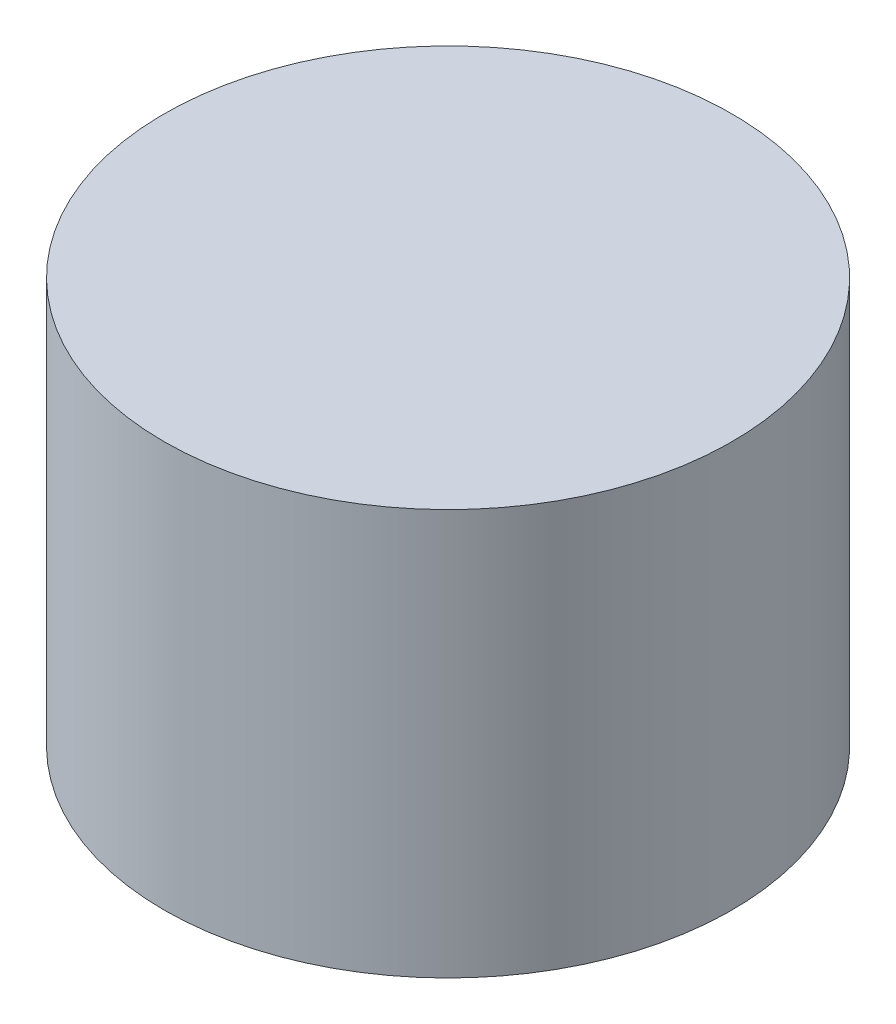
from build123d import *

# Parameters (mm, degrees)
SKETCH1_R           = 14
BOSS_EXTRUDE1_DEPTH = 20


with BuildPart() as part:
    # Sketch1 → Boss-Extrude1 (new body)
    with BuildSketch(Plane(origin=(0, 0, 0), x_dir=(1, 0, 0), z_dir=(0, 1, 0))):
        Circle(SKETCH1_R)
    extrude(amount=BOSS_EXTRUDE1_DEPTH)


solid = part.part
